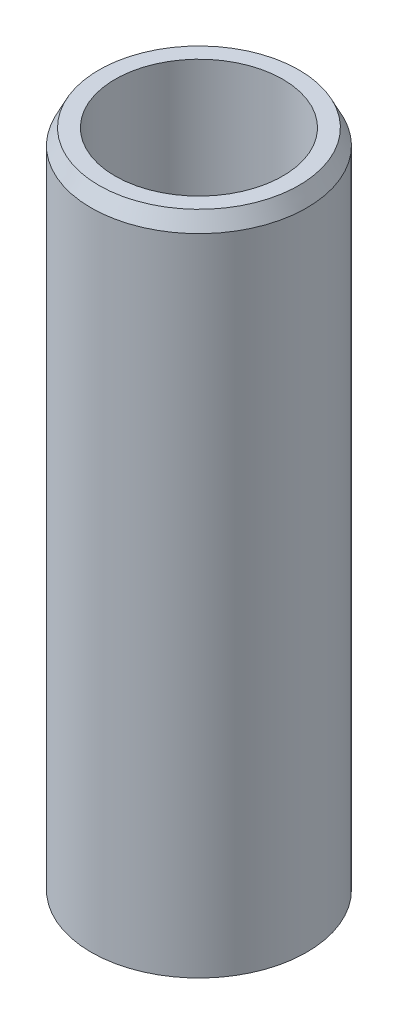
from build123d import *
from OCP.BRepFilletAPI import BRepFilletAPI_MakeChamfer

# Parameters (mm, degrees)
SKETCH1_R           = 32.5
BOSS_EXTRUDE1_DEPTH = 201.307233267
SKETCH2_R           = 25.272098608
CUT_EXTRUDE1_DEPTH  = 207.487535133
CHAMFER1_SIZE       = 4.686070805
CHAMFER1_SIZE2      = 2.352475178


with BuildPart() as part:
    # Sketch1 → Boss-Extrude1 (new body)
    with BuildSketch(Plane(origin=(0, 0, 0), x_dir=(1, 0, 0), z_dir=(0, 1, 0))):
        Circle(SKETCH1_R)
    extrude(amount=BOSS_EXTRUDE1_DEPTH)

    # Sketch2 → Cut-Extrude1 (cut, through all)
    with BuildSketch(Plane(origin=(0, 0, 0), x_dir=(1, 0, 0), z_dir=(0, 1, 0))):
        Circle(SKETCH2_R)
    extrude(amount=CUT_EXTRUDE1_DEPTH, mode=Mode.SUBTRACT)

    # Chamfer1: one chamfer whose edges measure the first distance from different faces: ONE call of the kernel's chamfer builder (chamfer() names one face for all edges)
    chamfer1_edges_1 = [part.edges().sort_by_distance(p)[0] for p in [
        (-32.5, 201.307233267, 0),
    ]]
    chamfer1_side_1 = [part.faces().sort_by_distance(p)[0] for p in [
        (-32.5, 100.653616633, 0),
    ]]
    chamfer1_edges_2 = [part.edges().sort_by_distance(p)[0] for p in [
        (-32.5, 0, 0),
    ]]
    chamfer1_side_2 = [part.faces().sort_by_distance(p)[0] for p in [
        (-31.580761184, 0, 0),
    ]]
    chamfer1 = BRepFilletAPI_MakeChamfer(part.part.solid().wrapped)
    for e in chamfer1_edges_1:
        chamfer1.Add(CHAMFER1_SIZE, CHAMFER1_SIZE2, e.wrapped, chamfer1_side_1[0].wrapped)  # the first distance lies on this face
    for e in chamfer1_edges_2:
        chamfer1.Add(CHAMFER1_SIZE, CHAMFER1_SIZE2, e.wrapped, chamfer1_side_2[0].wrapped)  # the first distance lies on this face
    add(Compound.cast(chamfer1.Shape()), mode=Mode.REPLACE)


solid = part.part
